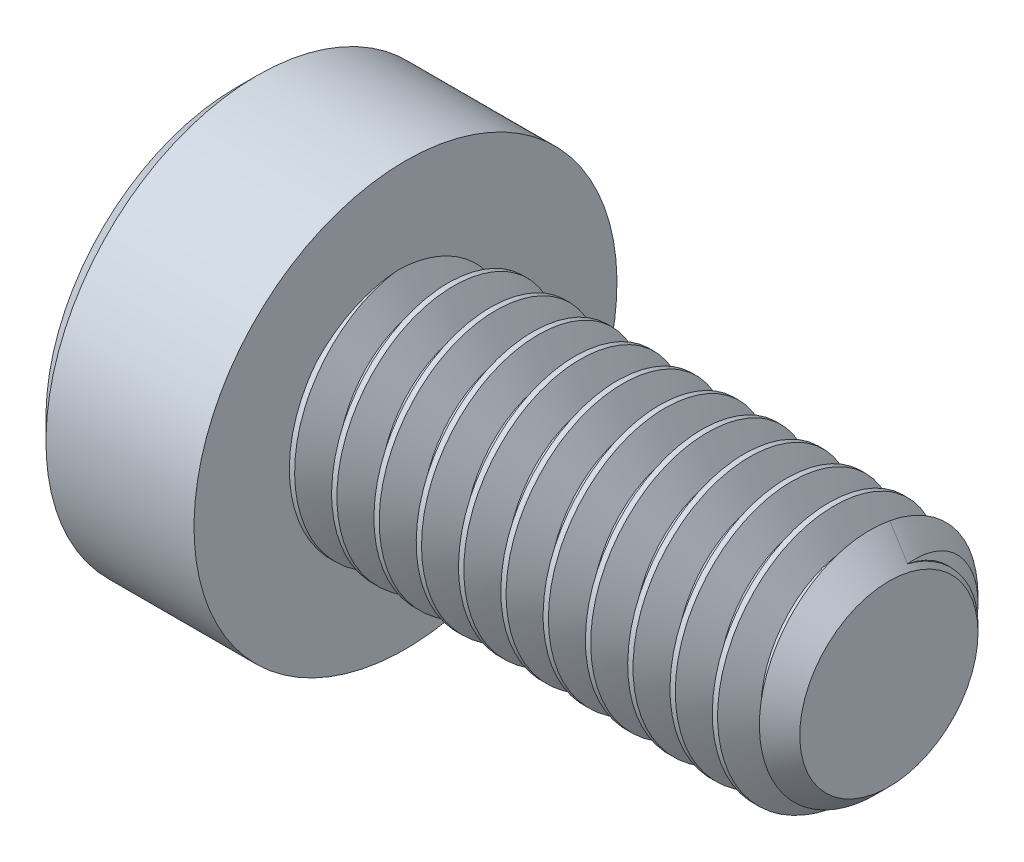
from build123d import *

# Parameters (mm, degrees)
SKETCH2_R           = 2
BOSS_EXTRUDE1_DEPTH = 8
CHAMFER1_SIZE       = 0.525
CUT_SWEEP1_PITCH    = 0.7
CUT_EXTRUDE1_DEPTH  = 2.42


with BuildPart() as part:
    # Sketch2 → Boss-Extrude1 (new body)
    with BuildSketch(Plane(origin=(4, 0, 0), x_dir=(0, 0, -1), z_dir=(1, 0, 0))):
        Circle(SKETCH2_R)
    extrude(amount=-BOSS_EXTRUDE1_DEPTH)

    # Chamfer1
    chamfer1_edges = [part.edges().sort_by_distance(p)[0] for p in [
        (4, 0, 2),
    ]]
    chamfer(chamfer1_edges, length=CHAMFER1_SIZE)

    # Cut-Sweep1: the profile of Sketch5 profile screwed along a right-hand helix of 12.428571 turns, 6 arcs to a turn; built about Z, then put on its axis
    cut_sweep1_z = Axis((0, 0, 0), (0, 0, 1))
    cut_sweep1_corners = [(2.0003, 0, 0.306423205), (2.0003, 0, -0.306423205), (1.545336663, 0, -0.04375), (1.545336663, 0, 0.04375)]
    with BuildLine(mode=Mode.PRIVATE) as cut_sweep1_profile:
        Line(cut_sweep1_corners[0], cut_sweep1_corners[1])
        Line(cut_sweep1_corners[1], cut_sweep1_corners[2])
        Line(cut_sweep1_corners[2], cut_sweep1_corners[3])
        Line(cut_sweep1_corners[3], cut_sweep1_corners[0])
    cut_sweep1_cap = Face(cut_sweep1_profile.wire())
    cut_sweep1_turn_angles = [0, 30, 60, 90, 120, 150, 180, 210, 240, 270, 300, 330, 360]
    cut_sweep1_turn_weights = [1, 0.8660254037844387, 1, 0.8660254037844387, 1, 0.8660254037844387, 1, 0.8660254037844387, 1, 0.8660254037844387, 1, 0.8660254037844387, 1]
    cut_sweep1_turn_rails = [Edge.make_bspline([Vector(p[0], p[1], 0).rotate(cut_sweep1_z, cut_sweep1_turn_angles[k]) / cut_sweep1_turn_weights[k] + Vector(0, 0, p[2] + CUT_SWEEP1_PITCH * cut_sweep1_turn_angles[k] / 360) for k in range(13)], [0, 0, 0, 1, 1, 2, 2, 3, 3, 4, 4, 5, 5, 6, 6, 6], 2, cut_sweep1_turn_weights) for p in cut_sweep1_corners]
    cut_sweep1_turn_sides = [Face.make_surface_from_curves(cut_sweep1_turn_rails[p[0]], cut_sweep1_turn_rails[p[1]]) for p in [(0, 1), (1, 2), (2, 3), (3, 0)]]
    cut_sweep1_last_angles = [4320, 4350, 4380, 4410, 4440, 4457.142857143, 4474.285714286]
    cut_sweep1_last_weights = [1, 0.8660254037844387, 1, 0.8660254037844387, 1, 0.9555728057861608, 1]
    cut_sweep1_last_rails = [Edge.make_bspline([Vector(p[0], p[1], 0).rotate(cut_sweep1_z, cut_sweep1_last_angles[k]) / cut_sweep1_last_weights[k] + Vector(0, 0, p[2] + CUT_SWEEP1_PITCH * cut_sweep1_last_angles[k] / 360) for k in range(7)], [0, 0, 0, 1, 1, 2, 2, 3, 3, 3], 2, cut_sweep1_last_weights) for p in cut_sweep1_corners]
    cut_sweep1_last_sides = [Face.make_surface_from_curves(cut_sweep1_last_rails[p[0]], cut_sweep1_last_rails[p[1]]) for p in [(0, 1), (1, 2), (2, 3), (3, 0)]]
    cut_sweep1 = Plane(origin=(4, 0, 0), x_dir=(0, 1, 0), z_dir=(-1, 0, 0)) * Solid(Shell([*[p.moved(Location((0, 0, CUT_SWEEP1_PITCH * i))) for i in range(12) for p in cut_sweep1_turn_sides], *cut_sweep1_last_sides, cut_sweep1_cap, cut_sweep1_cap.rotate(cut_sweep1_z, 4474.285714286).moved(Location((0, 0, CUT_SWEEP1_PITCH * 4474.285714286 / 360)))]))
    add(cut_sweep1, mode=Mode.SUBTRACT)

    # Sketch6 → Revolve1 (revolve)
    with BuildSketch(Plane.XY, mode=Mode.PRIVATE) as revolve1_sk:
        Polygon((-6.45, 3.5), (-6.8, 3.15), (-6.8, 0), (-4, 0), (-4, 3.5), align=None)
    revolve(revolve1_sk.sketch.rotate(Axis((-4, 0, 0), (-1, 0, 0)), 14.209880149), axis=Axis((-4, 0, 0), (-1, 0, 0)))

    # Sketch4 → Cut-Extrude1 (cut)
    with BuildSketch(Plane(origin=(-6.8, 0, 0), x_dir=(0, 0, -1), z_dir=(1, 0, 0))):
        Polygon((0, 1.443375673), (-1.25, 0.721687836), (-1.25, -0.721687836), (0, -1.443375673), (1.25, -0.721687836), (1.25, 0.721687836), align=None)
    extrude(amount=CUT_EXTRUDE1_DEPTH, mode=Mode.SUBTRACT)

    # Cut-Extrude2 cone 1 section (through the dimple's axis) → Cut-Extrude2 (revolve, cut)
    with BuildSketch(Plane(origin=(-6.8, 0, 0), x_dir=(0, 0, 1), z_dir=(0, 1, 0))):
        Polygon((0, 0), (1.443375673, 0), (0, 1.443375673), align=None)
    revolve(axis=Axis((-6.8, 0, 0), (1, 0, 0)), mode=Mode.SUBTRACT)


solid = part.part
